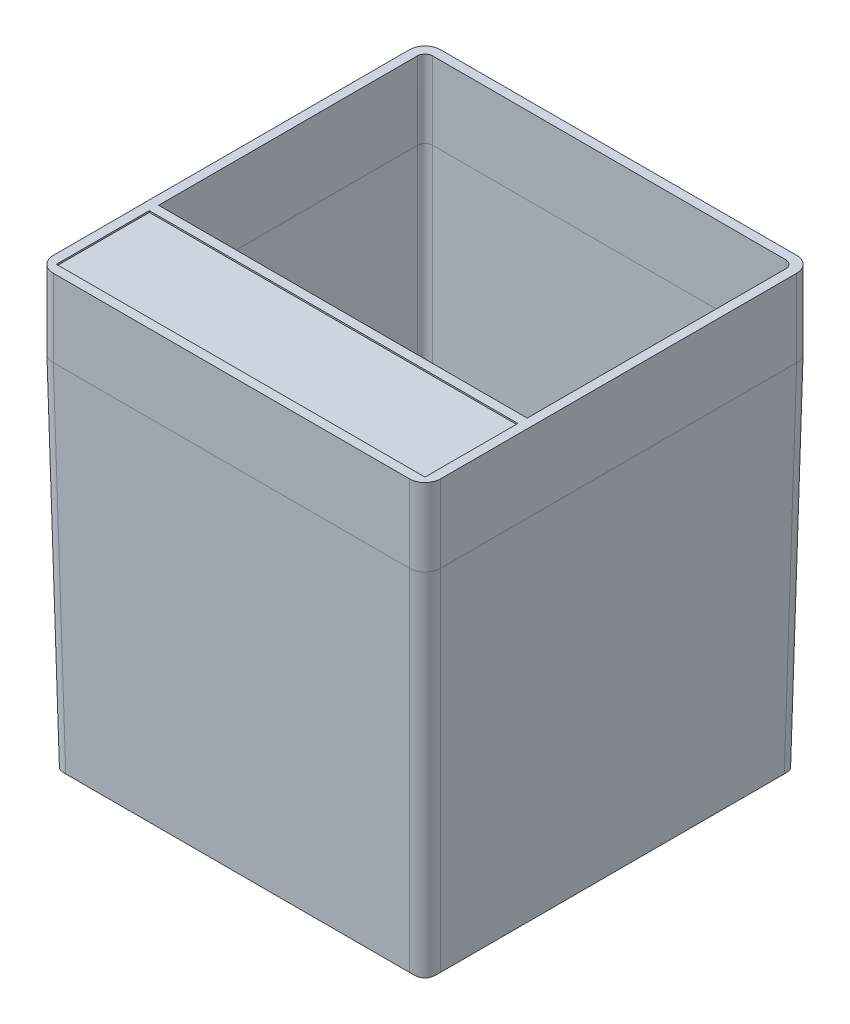
from build123d import *
from OCP.BRepFilletAPI import BRepFilletAPI_MakeChamfer

# Parameters (mm, degrees)
SKETCH1_W             = 50
SKETCH1_H             = 50
SKETCH1_W_2           = 47.6
SKETCH1_H_2           = 47.6
BOSS_EXTRUDE1_DEPTH   = 50
SKETCH1_3_W           = 42
SKETCH1_3_H           = 9.2
SKETCH1_3_H_2         = 1.2
SKETCH1_3_H_3         = 31.6
SKETCH1_3_W_2         = 2.8
BOSS_EXTRUDE2_DEPTH   = 1.2
DRAFT1_ANGLE          = -1
DRAFT2_ANGLE          = 1
BOSS_EXTRUDE3_START   = 50
SKETCH1_4_W           = 50
SKETCH1_4_H           = 50
SKETCH1_4_W_2         = 47.6
SKETCH1_4_H_2         = 47.6
BOSS_EXTRUDE3_DEPTH   = 10
BOSS_EXTRUDE4_START   = 60
SKETCH1_5_W           = 42
SKETCH1_5_H           = 9.2
SKETCH1_5_H_2         = 1.2
SKETCH1_5_W_2         = 2.8
BOSS_EXTRUDE4_DEPTH   = 0.8
DRAFT3_START          = 1.2
DRAFT3_DEPTH          = 47.6
CHAMFER2_SIZE         = 3
CHAMFER2_SIZE2        = 3.053760573
CHAMFER2_EDGE_2_SIZE  = 3
CHAMFER2_EDGE_2_SIZE2 = 3.053760573
CHAMFER2_EDGE_3_SIZE  = 3
CHAMFER2_EDGE_3_SIZE2 = 3.053760573
CHAMFER2_EDGE_4_SIZE  = 3
CHAMFER2_EDGE_4_SIZE2 = 3.053760573
CHAMFER4_SIZE         = 4
CHAMFER4_SIZE2        = 4.071680764
FILLET1_R             = 2
FILLET2_R             = 1
CUT_EXTRUDE3_START    = 60
SKETCH1_10_W          = 42
SKETCH1_10_H          = 9.2
CUT_EXTRUDE3_DEPTH    = 0.2


with BuildPart() as part:
    # Sketch1 → Boss-Extrude1 (new body)
    with BuildSketch(Plane(origin=(0, 0, 0), x_dir=(1, 0, 0), z_dir=(0, 1, 0))):
        with Locations((25, 25)):
            Rectangle(SKETCH1_W, SKETCH1_H)
        with Locations((25, 25)):
            Rectangle(SKETCH1_W_2, SKETCH1_H_2, mode=Mode.SUBTRACT)
    extrude(amount=BOSS_EXTRUDE1_DEPTH)

    # Sketch1<3> → Boss-Extrude2 (add)
    with BuildSketch(Plane(origin=(0, 0, 0), x_dir=(1, 0, 0), z_dir=(0, 1, 0))):
        with Locations((25, 8.6)):
            Rectangle(SKETCH1_3_W, SKETCH1_3_H)
        with Locations((25, 13.8)):
            Rectangle(SKETCH1_3_W, SKETCH1_3_H_2)
        with Locations((25, 30.2)):
            Rectangle(SKETCH1_3_W, SKETCH1_3_H_3)
        Polygon((4, 14.4), (4, 46), (46, 46), (46, 14.4), (48.8, 14.4), (48.8, 48.8), (1.2, 48.8), (1.2, 14.4), align=None)
        Polygon((4, 4), (4, 13.2), (1.2, 13.2), (1.2, 1.2), (48.8, 1.2), (48.8, 13.2), (46, 13.2), (46, 4), align=None)
        with Locations((2.6, 13.8)):
            Rectangle(SKETCH1_3_W_2, SKETCH1_3_H_2)
        with Locations((47.4, 13.8)):
            Rectangle(SKETCH1_3_W_2, SKETCH1_3_H_2)
    extrude(amount=BOSS_EXTRUDE2_DEPTH)

    # Draft1
    draft1_faces = [part.faces().sort_by_distance(p)[0] for p in [
        (0, 25, -25),
        (25, 25, -50),
        (50, 25, -25),
        (25, 25, 0),
    ]]
    draft(draft1_faces, Plane.ZX.offset(50), DRAFT1_ANGLE)

    # Draft2
    draft2_faces = [part.faces().sort_by_distance(p)[0] for p in [
        (25, 25.6, -48.8),
        (1.2, 25.6, -25),
        (48.8, 25.6, -25),
        (25, 25.6, -1.2),
    ]]
    draft(draft2_faces, Plane.ZX.offset(50), DRAFT2_ANGLE)

    # Sketch1<4> → Boss-Extrude3 (add)
    with BuildSketch(Plane(origin=(0, 0, 0), x_dir=(1, 0, 0), z_dir=(0, 1, 0)).offset(BOSS_EXTRUDE3_START)):
        with Locations((25, 25)):
            Rectangle(SKETCH1_4_W, SKETCH1_4_H)
        with Locations((25, 25)):
            Rectangle(SKETCH1_4_W_2, SKETCH1_4_H_2, mode=Mode.SUBTRACT)
    extrude(amount=BOSS_EXTRUDE3_DEPTH)

    # Sketch1<5> → Boss-Extrude4 (add)
    with BuildSketch(Plane(origin=(0, 0, 0), x_dir=(1, 0, 0), z_dir=(0, 1, 0)).offset(BOSS_EXTRUDE4_START)):
        with Locations((25, 8.6)):
            Rectangle(SKETCH1_5_W, SKETCH1_5_H)
        with Locations((25, 13.8)):
            Rectangle(SKETCH1_5_W, SKETCH1_5_H_2)
        Polygon((4, 4), (4, 13.2), (1.2, 13.2), (1.2, 1.2), (48.8, 1.2), (48.8, 13.2), (46, 13.2), (46, 4), align=None)
        with Locations((47.4, 13.8)):
            Rectangle(SKETCH1_5_W_2, SKETCH1_5_H_2)
        with Locations((2.6, 13.8)):
            Rectangle(SKETCH1_5_W_2, SKETCH1_5_H_2)
    extrude(amount=-BOSS_EXTRUDE4_DEPTH)

    # Draft3: read off the stored shape, not the designer's step
    # Draft3 outline → Draft3 (add)
    with BuildSketch(Plane.YZ.offset(DRAFT3_START)):
        Polygon((50, -1.2), (46.06862245, -1.26862245), (59.2, -14.4), (59.2, -1.2), align=None)
    extrude(amount=DRAFT3_DEPTH)

    # Chamfer2
    chamfer2_edges = [part.edges().sort_by_distance(p)[0] for p in [
        (25, 1.2, -47.948192832),
    ]]
    chamfer2_side = [part.faces().sort_by_distance(p)[0] for p in [
        (25, 1.2, -25),
    ]]
    chamfer(chamfer2_edges, length=CHAMFER2_SIZE, length2=CHAMFER2_SIZE2, reference=chamfer2_side[0])

    # Chamfer2 edge 2
    chamfer2_edge_2_edges = [part.edges().sort_by_distance(p)[0] for p in [
        (2.051807168, 1.2, -25),
    ]]
    chamfer2_edge_2_side = [part.faces().sort_by_distance(p)[0] for p in [
        (25, 1.2, -25),
    ]]
    chamfer(chamfer2_edge_2_edges, length=CHAMFER2_EDGE_2_SIZE, length2=CHAMFER2_EDGE_2_SIZE2, reference=chamfer2_edge_2_side[0])

    # Chamfer2 edge 3
    chamfer2_edge_3_edges = [part.edges().sort_by_distance(p)[0] for p in [
        (25, 1.2, -2.051807168),
    ]]
    chamfer2_edge_3_side = [part.faces().sort_by_distance(p)[0] for p in [
        (25, 1.2, -25),
    ]]
    chamfer(chamfer2_edge_3_edges, length=CHAMFER2_EDGE_3_SIZE, length2=CHAMFER2_EDGE_3_SIZE2, reference=chamfer2_edge_3_side[0])

    # Chamfer2 edge 4
    chamfer2_edge_4_edges = [part.edges().sort_by_distance(p)[0] for p in [
        (47.948192832, 1.2, -25),
    ]]
    chamfer2_edge_4_side = [part.faces().sort_by_distance(p)[0] for p in [
        (25, 1.2, -25),
    ]]
    chamfer(chamfer2_edge_4_edges, length=CHAMFER2_EDGE_4_SIZE, length2=CHAMFER2_EDGE_4_SIZE2, reference=chamfer2_edge_4_side[0])

    # Chamfer4: one chamfer whose edges measure the first distance from different faces: ONE call of the kernel's chamfer builder (chamfer() names one face for all edges)
    chamfer4_edges_1 = [part.edges().sort_by_distance(p)[0] for p in [
        (0.872753246, 0, -25),
    ]]
    chamfer4_side_1 = [part.faces().sort_by_distance(p)[0] for p in [
        (0.433792523, 25.148042974, -25),
    ]]
    chamfer4_edges_2 = [part.edges().sort_by_distance(p)[0] for p in [
        (25, 0, -49.127246754),
    ]]
    chamfer4_side_2 = [part.faces().sort_by_distance(p)[0] for p in [
        (25, 25.148042974, -49.566207477),
    ]]
    chamfer4_edges_3 = [part.edges().sort_by_distance(p)[0] for p in [
        (49.127246754, 0, -25),
    ]]
    chamfer4_side_3 = [part.faces().sort_by_distance(p)[0] for p in [
        (49.566207477, 25.148042974, -25),
    ]]
    chamfer4_edges_4 = [part.edges().sort_by_distance(p)[0] for p in [
        (25, 0, -0.872753246),
    ]]
    chamfer4_side_4 = [part.faces().sort_by_distance(p)[0] for p in [
        (25, 25.148042974, -0.433792523),
    ]]
    chamfer4 = BRepFilletAPI_MakeChamfer(part.part.solid().wrapped)
    for e in chamfer4_edges_1:
        chamfer4.Add(CHAMFER4_SIZE, CHAMFER4_SIZE2, e.wrapped, chamfer4_side_1[0].wrapped)  # the first distance lies on this face
    for e in chamfer4_edges_2:
        chamfer4.Add(CHAMFER4_SIZE, CHAMFER4_SIZE2, e.wrapped, chamfer4_side_2[0].wrapped)  # the first distance lies on this face
    for e in chamfer4_edges_3:
        chamfer4.Add(CHAMFER4_SIZE, CHAMFER4_SIZE2, e.wrapped, chamfer4_side_3[0].wrapped)  # the first distance lies on this face
    for e in chamfer4_edges_4:
        chamfer4.Add(CHAMFER4_SIZE, CHAMFER4_SIZE2, e.wrapped, chamfer4_side_4[0].wrapped)  # the first distance lies on this face
    add(Compound.cast(chamfer4.Shape()), mode=Mode.REPLACE)

    # Fillet1
    # the kernel refuses this fillet: 2 mm, written as the material it takes off along each edge
    with BuildSketch(Plane(origin=(-0.843553781, 5.589394839, 0.843553781), x_dir=(0.8117883996686079, 0.40564694005466123, 0.4200597031229852), z_dir=(0.5839517053348507, -0.5639156068713114, -0.5839517053348507)), Plane(origin=(-0.843553781, 5.589394839, -50.843553781), x_dir=(-0.4200597031229874, 0.40564694005465957, 0.8117883996686076), z_dir=(0.5839517053348504, -0.5639156068713111, 0.5839517053348512))) as fillet1_piece_1:
        with BuildLine():
            CenterArc((FILLET1_R * 0.563915606871, -FILLET1_R), FILLET1_R, 90, 58.838659397)
            Line((-FILLET1_R * 0.291797988867, -FILLET1_R * 0.482550251649), (0, 0))
            Line((0, 0), (FILLET1_R * 0.563915606871, 0))
        make_face()
    extrude(amount=12.7313357, mode=Mode.SUBTRACT)
    with BuildSketch(Plane(origin=(50.843553781, 5.589394839, 0.843553781), x_dir=(-0.8117883996686076, 0.4056469400546599, 0.420059703122987), z_dir=(-0.5839517053348513, -0.5639156068713113, -0.5839517053348505)), Plane(origin=(50.843553781, 5.589394839, -50.843553781), x_dir=(0.420059703122986, 0.4056469400546607, 0.8117883996686078), z_dir=(-0.583951705334851, -0.5639156068713108, 0.583951705334851))) as fillet1_piece_2:
        with BuildLine():
            CenterArc((FILLET1_R * 0.563915606871, FILLET1_R), FILLET1_R, 211.161340603, 58.838659397)
            Line((-FILLET1_R * 0.291797988867, FILLET1_R * 0.482550251649), (0, 0))
            Line((0, 0), (FILLET1_R * 0.563915606871, 0))
        make_face()
    extrude(amount=12.7313357, mode=Mode.SUBTRACT)
    with BuildSketch(Plane(origin=(0.890165796, -0.997564282, -0.890165796), x_dir=(0.9998477415357947, 0.017447091479365802, 0.0003045401145796421), z_dir=(-0.017449749160682707, 0.9996954598818875, 0.017449749160682707)), Plane(origin=(0.890165796, -0.997564282, -49.109834204), x_dir=(-0.0003045401145796421, 0.017447091479365802, 0.9998477415357947), z_dir=(-0.017449749160682707, 0.9996954598818875, -0.017449749160682707))) as fillet1_piece_3:
        with BuildLine():
            CenterArc((FILLET1_R * 0.999695459882, FILLET1_R), FILLET1_R, 180.017451521, 89.982548479)
            Line((-FILLET1_R * 0.000304493731645, FILLET1_R * 0.99969541351), (0, 0))
            Line((0, 0), (FILLET1_R * 0.999695459882, 0))
        make_face()
    extrude(amount=56.011577117, mode=Mode.SUBTRACT)
    with BuildSketch(Plane(origin=(49.109834204, -0.997564282, -49.109834204), x_dir=(0.0003045401145816405, 0.017447091479365767, 0.9998477415357947), z_dir=(0.017449749160682707, 0.9996954598818875, -0.017449749160682707)), Plane(origin=(49.109834204, -0.997564282, -0.890165796), x_dir=(-0.9998477415357947, 0.01744709147936578, 0.00030454011458086336), z_dir=(0.017449749160682707, 0.9996954598818875, 0.017449749160682707))) as fillet1_piece_4:
        with BuildLine():
            CenterArc((FILLET1_R * 0.999695459882, -FILLET1_R), FILLET1_R, 90, 89.982548479)
            Line((-FILLET1_R * 0.000304493731644, -FILLET1_R * 0.99969541351), (0, 0))
            Line((0, 0), (FILLET1_R * 0.999695459882, 0))
        make_face()
    extrude(amount=56.011577117, mode=Mode.SUBTRACT)
    with BuildSketch(Plane(origin=(0, 45, -50), x_dir=(0, 0, 1), z_dir=(0, 1, 0)), Plane(origin=(0, 45, 0), x_dir=(1, 0, 0), z_dir=(0, 1, 0))) as fillet1_piece_5:
        with BuildLine():
            CenterArc((FILLET1_R, FILLET1_R), FILLET1_R, 180, 90)
            Line((0, FILLET1_R), (0, 0))
            Line((0, 0), (FILLET1_R, 0))
        make_face()
    extrude(amount=20, mode=Mode.SUBTRACT)
    with BuildSketch(Plane(origin=(50, 45, 0), x_dir=(-1, 0, 0), z_dir=(0, 1, 0)), Plane(origin=(50, 45, -50), x_dir=(0, 0, 1), z_dir=(0, 1, 0))) as fillet1_piece_6:
        with BuildLine():
            CenterArc((FILLET1_R, -FILLET1_R), FILLET1_R, 90, 90)
            Line((0, -FILLET1_R), (0, 0))
            Line((0, 0), (FILLET1_R, 0))
        make_face()
    extrude(amount=20, mode=Mode.SUBTRACT)

    # Fillet2
    # the kernel refuses this fillet: 1 mm, written as the material it adds along each edge
    with BuildSketch(Plane(origin=(5.885140502, 0.366666667, -5.885140502), x_dir=(-0.40824829046386174, 0.4082482904638633, -0.8164965809277265), z_dir=(-0.5773502691896252, 0.5773502691896272, 0.5773502691896252))) as fillet2_piece_1_section:
        with BuildLine():
            CenterArc((FILLET2_R * 0.57735026919, -FILLET2_R), FILLET2_R, 90, 60)
            Line((-FILLET2_R * 0.288675134595, -FILLET2_R * 0.5), (0, 0))
            Line((0, 0), (FILLET2_R * 0.57735026919, 0))
        make_face()
    fillet2_piece_1 = extrude(amount=8.175214232, mode=Mode.PRIVATE)
    fillet2_piece_1 = split(fillet2_piece_1, bisect_by=Plane(origin=(5.885140502, 0.300029787, -2.067516207), z_dir=(0, 0.017452406437283536, -0.9998476951563913)), keep=Keep.TOP, mode=Mode.PRIVATE)
    add(fillet2_piece_1)
    with BuildSketch(Plane(origin=(5.885140502, 0.366666667, -44.114859498), x_dir=(-0.4082482904638601, 0.4082482904638647, 0.8164965809277266), z_dir=(-0.5773502691896252, 0.5773502691896274, -0.577350269189625))) as fillet2_piece_2_section:
        with BuildLine():
            CenterArc((FILLET2_R * 0.57735026919, FILLET2_R), FILLET2_R, 210, 60)
            Line((-FILLET2_R * 0.288675134595, FILLET2_R * 0.5), (0, 0))
            Line((0, 0), (FILLET2_R * 0.57735026919, 0))
        make_face()
    fillet2_piece_2 = extrude(amount=8.175214232, mode=Mode.PRIVATE)
    fillet2_piece_2 = split(fillet2_piece_2, bisect_by=Plane(origin=(5.885140502, 0.300029787, -47.932483793), z_dir=(0, 0.017452406437283536, 0.9998476951563913)), keep=Keep.TOP, mode=Mode.PRIVATE)
    add(fillet2_piece_2)
    with BuildSketch(Plane(origin=(44.114859498, 0.366666667, -5.885140502), x_dir=(0.4082482904638648, 0.40824829046386013, -0.8164965809277265), z_dir=(0.577350269189625, 0.5773502691896274, 0.5773502691896252))) as fillet2_piece_3_section:
        with BuildLine():
            CenterArc((FILLET2_R * 0.57735026919, FILLET2_R), FILLET2_R, 210, 60)
            Line((-FILLET2_R * 0.288675134595, FILLET2_R * 0.5), (0, 0))
            Line((0, 0), (FILLET2_R * 0.57735026919, 0))
        make_face()
    fillet2_piece_3 = extrude(amount=8.175214232, mode=Mode.PRIVATE)
    fillet2_piece_3 = split(fillet2_piece_3, bisect_by=Plane(origin=(44.114859498, 0.300029787, -2.067516207), z_dir=(0, 0.017452406437283536, -0.9998476951563913)), keep=Keep.TOP, mode=Mode.PRIVATE)
    add(fillet2_piece_3)
    with BuildSketch(Plane(origin=(44.114859498, 0.366666667, -44.114859498), x_dir=(-0.8164965809277265, 0.4082482904638685, -0.40824829046385624), z_dir=(0.5773502691896251, 0.5773502691896274, -0.5773502691896251))) as fillet2_piece_4_section:
        with BuildLine():
            CenterArc((FILLET2_R * 0.57735026919, FILLET2_R), FILLET2_R, 210, 60)
            Line((-FILLET2_R * 0.288675134595, FILLET2_R * 0.5), (0, 0))
            Line((0, 0), (FILLET2_R * 0.57735026919, 0))
        make_face()
    fillet2_piece_4 = extrude(amount=8.175214232, mode=Mode.PRIVATE)
    fillet2_piece_4 = split(fillet2_piece_4, bisect_by=Plane(origin=(47.932483793, 0.300029787, -44.114859498), z_dir=(-0.9998476951563913, 0.017452406437283536, 0)), keep=Keep.TOP, mode=Mode.PRIVATE)
    add(fillet2_piece_4)
    with BuildSketch(Plane(origin=(47.957877215, 1.754817939, -47.957877215), x_dir=(-0.9998477415357947, 0.017447091479365767, -0.0003045401145816405), z_dir=(0.017449749160682707, 0.9996954598818875, -0.017449749160682707))) as fillet2_piece_5_section:
        with BuildLine():
            CenterArc((FILLET2_R * 0.999695459882, FILLET2_R), FILLET2_R, 180.017451521, 89.982548479)
            Line((-FILLET2_R * 0.000304493731648, FILLET2_R * 0.99969541351), (0, 0))
            Line((0, 0), (FILLET2_R * 0.999695459882, 0))
        make_face()
    fillet2_piece_5 = extrude(amount=50.75911778, mode=Mode.PRIVATE)
    fillet2_piece_5 = split(fillet2_piece_5, bisect_by=Plane(origin=(46.730443993, 2.982251161, -47.957877215), z_dir=(-0.707106781186549, 0.7071067811865461, 0)), keep=Keep.TOP, mode=Mode.PRIVATE)
    add(fillet2_piece_5)
    with BuildSketch(Plane(origin=(2.042122785, 1.754817939, -47.957877215), x_dir=(-0.00030454011457675554, 0.01744709147936585, 0.9998477415357947), z_dir=(-0.017449749160682707, 0.9996954598818875, -0.017449749160682707))) as fillet2_piece_6_section:
        with BuildLine():
            CenterArc((FILLET2_R * 0.999695459882, FILLET2_R), FILLET2_R, 180.017451521, 89.982548479)
            Line((-FILLET2_R * 0.000304493731643, FILLET2_R * 0.99969541351), (0, 0))
            Line((0, 0), (FILLET2_R * 0.999695459882, 0))
        make_face()
    fillet2_piece_6 = extrude(amount=50.75911778, mode=Mode.PRIVATE)
    fillet2_piece_6 = split(fillet2_piece_6, bisect_by=Plane(origin=(2.042122785, 2.982251161, -46.730443993), z_dir=(0, 0.7071067811865461, 0.707106781186549)), keep=Keep.TOP, mode=Mode.PRIVATE)
    add(fillet2_piece_6)
    with BuildSketch(Plane(origin=(1.2, 47.5, -48.8), x_dir=(0, 0, 1), z_dir=(0, 1, 0)), Plane(origin=(48.8, 47.5, -48.8), x_dir=(-1, 0, 0), z_dir=(0, 1, 0))) as fillet2_piece_7:
        with BuildLine():
            CenterArc((FILLET2_R, FILLET2_R), FILLET2_R, 180, 90)
            Line((0, FILLET2_R), (0, 0))
            Line((0, 0), (FILLET2_R, 0))
        make_face()
    extrude(amount=12.5)
    with BuildSketch(Plane(origin=(2.042122785, 1.754817939, -2.042122785), x_dir=(-0.0003045401145808143, 0.017447091479365778, -0.9998477415357947), z_dir=(-0.017449749160682707, 0.9996954598818875, 0.017449749160682707))) as fillet2_piece_8_section:
        with BuildLine():
            CenterArc((FILLET2_R * 0.999695459882, -FILLET2_R), FILLET2_R, 90, 89.982548479)
            Line((-FILLET2_R * 0.000304493731648, -FILLET2_R * 0.99969541351), (0, 0))
            Line((0, 0), (FILLET2_R * 0.999695459882, 0))
        make_face()
    fillet2_piece_8 = extrude(amount=46.826542603, mode=Mode.PRIVATE)
    fillet2_piece_8 = split(fillet2_piece_8, bisect_by=Plane(origin=(2.042122785, 2.982251161, -3.269556007), z_dir=(0, 0.7071067811865462, -0.7071067811865488)), keep=Keep.TOP, mode=Mode.PRIVATE)
    add(fillet2_piece_8)
    with BuildSketch(Plane(origin=(47.957877215, 1.754817939, -2.042122785), x_dir=(0.0003045401145816405, 0.017447091479365767, -0.9998477415357947), z_dir=(0.017449749160682707, 0.9996954598818875, 0.017449749160682707))) as fillet2_piece_9_section:
        with BuildLine():
            CenterArc((FILLET2_R * 0.999695459882, FILLET2_R), FILLET2_R, 180.017451521, 89.982548479)
            Line((-FILLET2_R * 0.000304493731647, FILLET2_R * 0.99969541351), (0, 0))
            Line((0, 0), (FILLET2_R * 0.999695459882, 0))
        make_face()
    fillet2_piece_9 = extrude(amount=46.826542603, mode=Mode.PRIVATE)
    fillet2_piece_9 = split(fillet2_piece_9, bisect_by=Plane(origin=(47.957877215, 2.982251161, -3.269556007), z_dir=(0, 0.7071067811865462, -0.7071067811865488)), keep=Keep.TOP, mode=Mode.PRIVATE)
    add(fillet2_piece_9)

    # Sketch1<10> → Cut-Extrude3 (cut)
    with BuildSketch(Plane(origin=(0, 0, 0), x_dir=(1, 0, 0), z_dir=(0, 1, 0)).offset(CUT_EXTRUDE3_START)):
        with Locations((25, 8.6)):
            Rectangle(SKETCH1_10_W, SKETCH1_10_H)
        Polygon((4, 4), (4, 13.2), (1.2, 13.2), (1.2, 1.2), (48.8, 1.2), (48.8, 13.2), (46, 13.2), (46, 4), align=None)
    extrude(amount=-CUT_EXTRUDE3_DEPTH, mode=Mode.SUBTRACT)


solid = part.part
